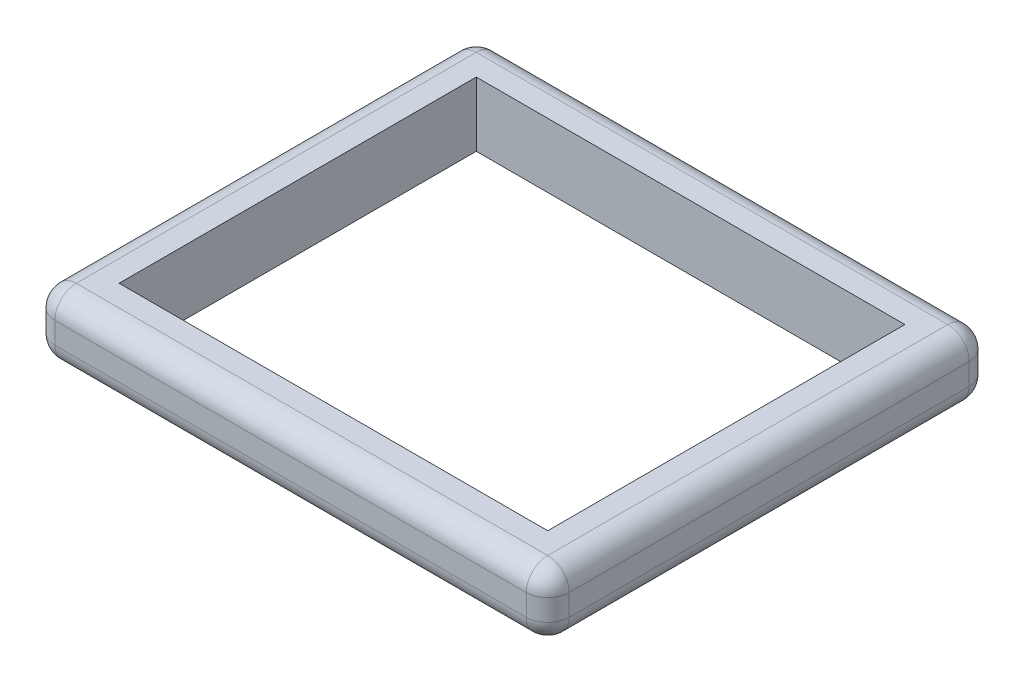
from build123d import *

# Parameters (mm, degrees)
SKETCH1_W           = 914.4
SKETCH1_H           = 787.4
SKETCH1_W_2         = 762
SKETCH1_H_2         = 635
BOSS_EXTRUDE1_DEPTH = 114.3
FILLET2_R           = 38.1
FILLET3_R           = 38.1
FILLET4_R           = 38.1


with BuildPart() as part:
    # Sketch1 → Boss-Extrude1 (new body)
    with BuildSketch(Plane(origin=(0, 0, 0), x_dir=(1, 0, 0), z_dir=(0, 1, 0))):
        Rectangle(SKETCH1_W, SKETCH1_H)
        Rectangle(SKETCH1_W_2, SKETCH1_H_2, mode=Mode.SUBTRACT)
    extrude(amount=BOSS_EXTRUDE1_DEPTH)

    # Fillet2
    fillet2_edges = [part.edges().sort_by_distance(p)[0] for p in [
        (457.2, 57.15, 393.7),
        (-457.2, 57.15, 393.7),
        (-457.2, 57.15, -393.7),
        (457.2, 57.15, -393.7),
    ]]
    fillet(fillet2_edges, radius=FILLET2_R)

    # Fillet3
    fillet3_edges = [part.edges().sort_by_distance(p)[0] for p in [
        (446.040768363, 114.3, 382.540768363),
        (0, 114.3, 393.7),
        (-446.040768363, 114.3, 382.540768363),
        (-457.2, 114.3, 0),
        (-446.040768363, 114.3, -382.540768363),
        (0, 114.3, -393.7),
        (446.040768363, 114.3, -382.540768363),
        (457.2, 114.3, 0),
    ]]
    fillet(fillet3_edges, radius=FILLET3_R)

    # Fillet4
    fillet4_edges = [part.edges().sort_by_distance(p)[0] for p in [
        (446.040768363, 0, 382.540768363),
        (0, 0, 393.7),
        (-446.040768363, 0, 382.540768363),
        (-457.2, 0, 0),
        (-446.040768363, 0, -382.540768363),
        (0, 0, -393.7),
        (446.040768363, 0, -382.540768363),
        (457.2, 0, 0),
    ]]
    fillet(fillet4_edges, radius=FILLET4_R)


solid = part.part
